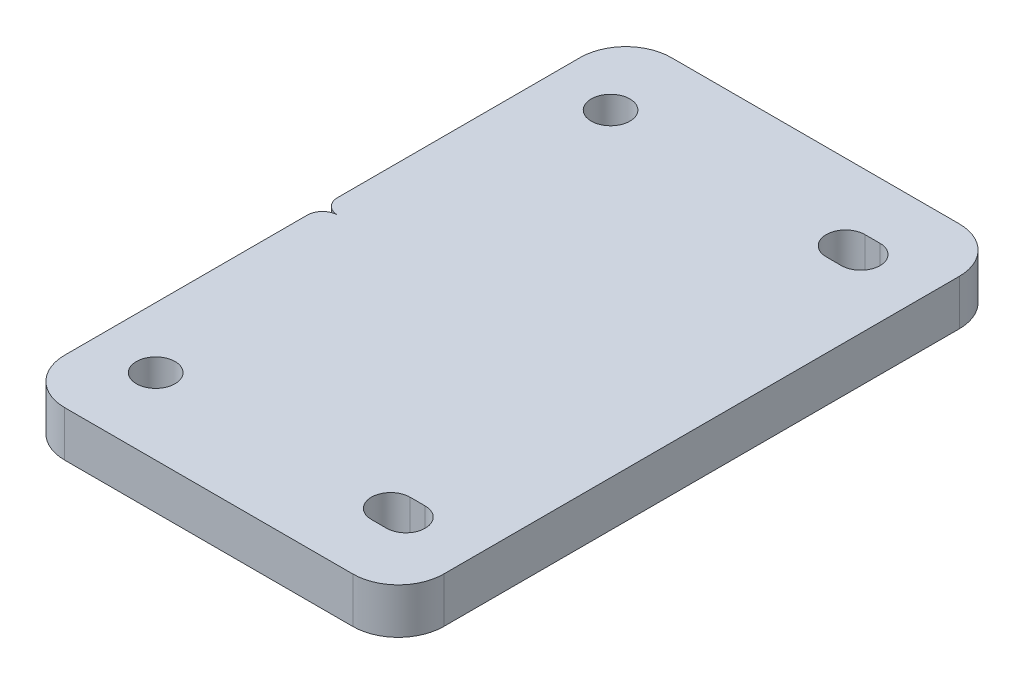
from build123d import *

# Parameters (mm, degrees)
EXTRUDE_1_DEPTH     = 6
SKETCH_2_R          = 2.55
CUT_EXTRUDE_1_DEPTH = 48.549973712
CUT_EXTRUDE_2_DEPTH = 48.549973712


with BuildPart() as part:
    # Эскиз1 → Бобышка-Вытянуть1 (new body)
    with BuildSketch(Plane(origin=(0, 0, 0), x_dir=(1, 0, 0), z_dir=(0, 1, 0))):
        with BuildLine():
            Line((-19, -40), (19, -40))
            ThreePointArc((19, -40), (23.242640687, -38.242640687), (25, -34))
            Line((25, -34), (25, 34))
            ThreePointArc((25, 34), (23.242640687, 38.242640687), (19, 40))
            Line((19, 40), (-19, 40))
            ThreePointArc((-19, 40), (-23.242640687, 38.242640687), (-25, 34))
            Line((-25, 34), (-25, -34))
            ThreePointArc((-25, -34), (-23.242640687, -38.242640687), (-19, -40))
        make_face()
    extrude(amount=EXTRUDE_1_DEPTH)

    # Эскиз2 → Вырез-Вытянуть1 (cut, through all)
    with BuildSketch(Plane.XZ):
        with Locations((-17, -30)):
            Circle(SKETCH_2_R)
        with Locations((-17, 30)):
            Circle(SKETCH_2_R)
        with BuildLine():
            Line((16, -32.55), (14, -32.55))
            ThreePointArc((14, -32.55), (11.45, -30), (14, -27.45))
            Line((14, -27.45), (16, -27.45))
            ThreePointArc((16, -27.45), (18.55, -30), (16, -32.55))
        make_face()
        with BuildLine():
            Line((16, 32.55), (14, 32.55))
            ThreePointArc((14, 32.55), (11.45, 30), (14, 27.45))
            Line((14, 27.45), (16, 27.45))
            ThreePointArc((16, 27.45), (18.55, 30), (16, 32.55))
        make_face()
    extrude(amount=-CUT_EXTRUDE_1_DEPTH, mode=Mode.SUBTRACT)

    # Эскиз3 → Вырез-Вытянуть2 (cut, through all)
    with BuildSketch(Plane.XZ):
        with BuildLine():
            Line((-25, -2), (-25, 2))
            ThreePointArc((-25, 2), (-24.414213562, 0.585786438), (-23, 0))
            ThreePointArc((-23, 0), (-24.414213562, -0.585786438), (-25, -2))
        make_face()
    extrude(amount=-CUT_EXTRUDE_2_DEPTH, mode=Mode.SUBTRACT)


solid = part.part
